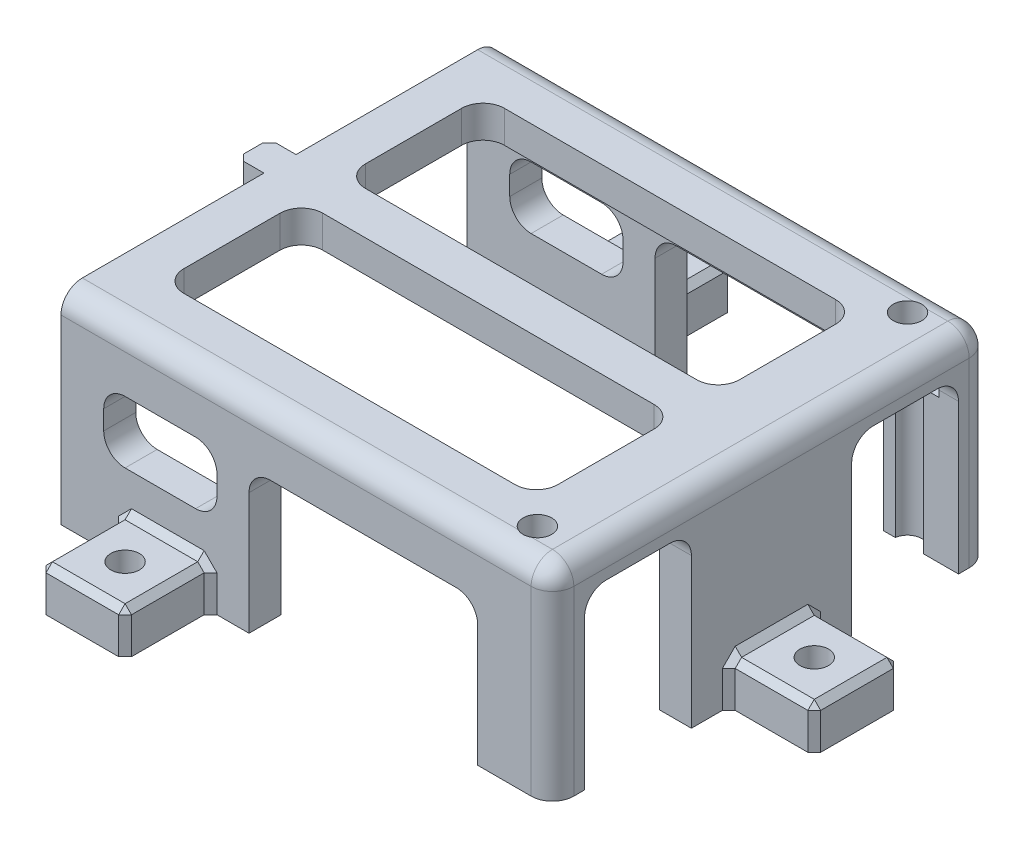
from build123d import *

# Parameters (mm, degrees)
BOSS_EXTRUDE1_DEPTH      = 20.32
SKETCH2_W                = 58.42
SKETCH2_H                = 52.07
BOSS_EXTRUDE2_DEPTH      = 3.81
SKETCH3_W                = 12.7
SKETCH3_H                = 20.32
CUT_EXTRUDE1_DEPTH       = 3.81
FILLET2_R                = 2.54
SKETCH4_W                = 10.16
SKETCH4_H                = 5.08
BOSS_EXTRUDE3_DEPTH      = 10.16
CHAMFER1_SIZE            = 0.762
SKETCH5_W                = 10.16
SKETCH5_H                = 5.08
BOSS_EXTRUDE4_DEPTH      = 10.16
CHAMFER2_SIZE            = 0.762
CHAMFER2_OF_MIRROR1_SIZE = 0.762
M3_CLEARANCE_HOLE1_D     = 3.4
M3_CLEARANCE_HOLE2_D     = 3.4
CUT_EXTRUDE2_REACH       = 61.966
SKETCH13_W               = 44.45
SKETCH13_H               = 16.51
SKETCH15_W               = 13.462
SKETCH15_H               = 7.366
CUT_EXTRUDE4_DEPTH       = 79.475827011
FILLET3_R                = 2.54
SKETCH16_W               = 6.35
SKETCH16_H               = 3.81
BOSS_EXTRUDE5_DEPTH      = 3.81
CHAMFER3_SIZE            = 0.762
M3_CLEARANCE_HOLE4_D     = 3.4
CUT_EXTRUDE5_DEPTH       = 3.302
FILLET4_R                = 2.54


with BuildPart() as part:
    # Sketch1 → Boss-Extrude1 (new body)
    with BuildSketch(Plane(origin=(0, 0, 0), x_dir=(1, 0, 0), z_dir=(0, 1, 0))):
        Polygon((-27.305, 22.225), (-27.305, 26.035), (31.115, 26.035), (31.115, -26.035), (-27.305, -26.035), (-27.305, -22.225), (27.305, -22.225), (27.305, 22.225), align=None)
    extrude(amount=BOSS_EXTRUDE1_DEPTH)

    # Sketch2 → Boss-Extrude2 (add)
    with BuildSketch(Plane(origin=(0, 20.32, 0), x_dir=(1, 0, 0), z_dir=(0, 1, 0))):
        with Locations((1.905, 0)):
            Rectangle(SKETCH2_W, SKETCH2_H)
    extrude(amount=BOSS_EXTRUDE2_DEPTH)

    # Sketch3 → Cut-Extrude1 (cut)
    with BuildSketch(Plane.ZY.offset(-27.305)):
        with Locations((-15.875, 10.16)):
            Rectangle(SKETCH3_W, SKETCH3_H)
        with Locations((15.875, 10.16)):
            Rectangle(SKETCH3_W, SKETCH3_H)
    extrude(amount=-CUT_EXTRUDE1_DEPTH, mode=Mode.SUBTRACT)

    # Fillet2
    fillet2_edges = [part.edges().sort_by_distance(p)[0] for p in [
        (31.115, 12.065, -26.035),
        (31.115, 12.065, 26.035),
        (31.115, 24.13, 0),
    ]]
    fillet(fillet2_edges, radius=FILLET2_R)

    # Sketch4 → Boss-Extrude3 (add)
    with BuildSketch(Plane(origin=(31.115, 0, 0), x_dir=(0, 0, -1), z_dir=(1, 0, 0))):
        with Locations((0, 2.54)):
            Rectangle(SKETCH4_W, SKETCH4_H)
    extrude(amount=BOSS_EXTRUDE3_DEPTH)

    # Chamfer1
    chamfer1_edges = [part.edges().sort_by_distance(p)[0] for p in [
        (31.115, 2.54, 5.08),
        (36.195, 5.08, 5.08),
        (31.115, 2.54, -5.08),
        (31.115, 5.08, 0),
        (36.195, 5.08, -5.08),
        (41.275, 2.54, 5.08),
        (41.275, 2.54, -5.08),
        (41.275, 5.08, 0),
    ]]
    chamfer(chamfer1_edges, length=CHAMFER1_SIZE)

    # Sketch5 → Boss-Extrude4 (add)
    with BuildSketch(Plane.XY.offset(26.035)):
        with Locations((-14.605, 2.54)):
            Rectangle(SKETCH5_W, SKETCH5_H)
    boss_extrude4 = extrude(amount=BOSS_EXTRUDE4_DEPTH)

    # Chamfer2
    chamfer2_edges = [part.edges().sort_by_distance(p)[0] for p in [
        (-19.685, 2.54, 26.035),
        (-19.685, 5.08, 31.115),
        (-9.525, 2.54, 26.035),
        (-14.605, 5.08, 26.035),
        (-9.525, 5.08, 31.115),
        (-19.685, 2.54, 36.195),
        (-9.525, 2.54, 36.195),
        (-14.605, 5.08, 36.195),
    ]]
    chamfer(chamfer2_edges, length=CHAMFER2_SIZE)

    # Mirror1: Boss-Extrude4 across plane
    add(boss_extrude4.mirror(Plane.XY))

    # Chamfer2 of Mirror1
    chamfer2_of_mirror1_edges = [part.edges().sort_by_distance(p)[0] for p in [
        (-19.685, 2.54, -26.035),
        (-19.685, 5.08, -31.115),
        (-9.525, 2.54, -26.035),
        (-14.605, 5.08, -26.035),
        (-9.525, 5.08, -31.115),
        (-19.685, 2.54, -36.195),
        (-9.525, 2.54, -36.195),
        (-14.605, 5.08, -36.195),
    ]]
    chamfer(chamfer2_of_mirror1_edges, length=CHAMFER2_OF_MIRROR1_SIZE)

    # M3 Clearance Hole1 (through all)
    with Locations(Plane(origin=(0, 5.08, 0), x_dir=(1, 0, 0), z_dir=(0, 1, 0))):
        with Locations((-14.605, -31.115)):
            m3_clearance_hole1 = Hole(M3_CLEARANCE_HOLE1_D / 2)

    # Mirror2: M3 Clearance Hole1 across plane
    add(m3_clearance_hole1.mirror(Plane.XY), mode=Mode.SUBTRACT)

    # M3 Clearance Hole2 (through all)
    with Locations(Plane(origin=(0, 5.08, 0), x_dir=(1, 0, 0), z_dir=(0, 1, 0))):
        with Locations((36.195, 0)):
            Hole(M3_CLEARANCE_HOLE2_D / 2)

    # Sketch13 → Cut-Extrude2 (cut, up to next)
    with BuildSketch(Plane(origin=(0, 24.13, 0), x_dir=(1, 0, 0), z_dir=(0, 1, 0)), mode=Mode.PRIVATE) as cut_extrude2_sk1:
        with Locations((0, -10.795)):
            Rectangle(SKETCH13_W, SKETCH13_H)
    cut_extrude2_tool1 = extrude(cut_extrude2_sk1.sketch, amount=-CUT_EXTRUDE2_REACH, mode=Mode.PRIVATE) & part.part
    # Sketch13 → Cut-Extrude2 (cut, up to next)
    with BuildSketch(Plane(origin=(0, 24.13, 0), x_dir=(1, 0, 0), z_dir=(0, 1, 0)), mode=Mode.PRIVATE) as cut_extrude2_sk2:
        with Locations((0, 10.795)):
            Rectangle(SKETCH13_W, SKETCH13_H)
    cut_extrude2_tool2 = extrude(cut_extrude2_sk2.sketch, amount=-CUT_EXTRUDE2_REACH, mode=Mode.PRIVATE) & part.part
    add(cut_extrude2_tool1.solids().sort_by_distance((0, 24.13, 10.795))[0], mode=Mode.SUBTRACT)
    add(cut_extrude2_tool2.solids().sort_by_distance((0, 24.13, -10.795))[0], mode=Mode.SUBTRACT)

    # Sketch15 → Cut-Extrude4 (cut, through all)
    with BuildSketch(Plane(origin=(0, 0, -26.035), x_dir=(-1, 0, 0), z_dir=(0, 0, -1))):
        Polygon((-22.225, 0), (4.953, 0), (4.953, 9.652), (4.953, 17.018), (-22.225, 17.018), align=None)
        with Locations((15.494, 13.335)):
            Rectangle(SKETCH15_W, SKETCH15_H)
    extrude(amount=-CUT_EXTRUDE4_DEPTH, mode=Mode.SUBTRACT)

    # Fillet3
    fillet3_edges = [part.edges().sort_by_distance(p)[0] for p in [
        (-22.225, 22.225, 19.05),
        (-22.225, 22.225, 2.54),
        (1.905, 20.32, -22.225),
        (22.225, 22.225, 2.54),
        (22.225, 22.225, 19.05),
        (22.225, 22.225, -19.05),
        (22.225, 22.225, -2.54),
        (-22.225, 22.225, -2.54),
        (-22.225, 22.225, -19.05),
        (22.225, 17.018, 24.13),
        (22.225, 17.018, -24.13),
        (-4.953, 17.018, 24.13),
        (-4.953, 17.018, -24.13),
        (-22.225, 17.018, 24.13),
        (-22.225, 17.018, -24.13),
        (-22.225, 9.652, 24.13),
        (-22.225, 9.652, -24.13),
        (-8.763, 9.652, 24.13),
        (-8.763, 9.652, -24.13),
        (-8.763, 17.018, 24.13),
        (-8.763, 17.018, -24.13),
        (29.21, 20.32, -9.525),
        (29.21, 20.32, 9.525),
        (1.905, 20.32, 22.225),
    ]]
    fillet(fillet3_edges, radius=FILLET3_R)

    # Sketch16 → Boss-Extrude5 (add)
    with BuildSketch(Plane(origin=(0, 24.13, 0), x_dir=(1, 0, 0), z_dir=(0, 1, 0))):
        with Locations((-27.305, 0)):
            Rectangle(SKETCH16_W, SKETCH16_H)
    extrude(amount=-BOSS_EXTRUDE5_DEPTH)

    # Chamfer3
    chamfer3_edges = [part.edges().sort_by_distance(p)[0] for p in [
        (-28.8925, 20.32, -1.905),
        (-28.8925, 20.32, 1.905),
        (-30.48, 20.32, 0),
        (-30.48, 22.225, -1.905),
        (-30.48, 22.225, 1.905),
    ]]
    chamfer(chamfer3_edges, length=CHAMFER3_SIZE)

    # M3 Clearance Hole4 (through all)
    with Locations(Plane(origin=(0, 24.13, 0), x_dir=(1, 0, 0), z_dir=(0, 1, 0))):
        with Locations((25.286866606, -21.9964), (25.286866606, 21.9964)):
            Hole(M3_CLEARANCE_HOLE4_D / 2)

    # Sketch22 → Cut-Extrude5 (cut)
    with BuildSketch(Plane.XZ.offset(-20.32)):
        Polygon((28.953040816, 21.9964), (27.119953711, 25.1714), (23.453779502, 25.1714), (21.620692397, 21.9964), (23.453779502, 18.8214), (27.119953711, 18.8214), align=None)
        Polygon((28.953040816, -21.9964), (27.119953711, -18.8214), (23.453779502, -18.8214), (21.620692397, -21.9964), (23.453779502, -25.1714), (27.119953711, -25.1714), align=None)
    extrude(amount=CUT_EXTRUDE5_DEPTH, mode=Mode.SUBTRACT)

    # Fillet4
    # the kernel refuses this fillet: 2.54 mm, written as the material it takes off along each edge
    with BuildSketch(Plane(origin=(28.575, 21.59, 23.495), x_dir=(0, 0, 1), z_dir=(0, 1, 0))) as fillet4_piece_1_section:
        Polygon((0, 0), (FILLET4_R, 0), (FILLET4_R, FILLET4_R), (0, FILLET4_R), align=None)
    fillet4_piece_1 = extrude(amount=FILLET4_R, mode=Mode.PRIVATE)
    fillet4_piece_1 = fillet4_piece_1 - Plane(origin=(28.575, 21.59, 23.495), x_dir=(-0.7071067811865475, 0, -0.7071067811865475), z_dir=(0, 1, 0)) * Sphere(FILLET4_R, mode=Mode.PRIVATE)
    add(fillet4_piece_1, mode=Mode.SUBTRACT)
    with BuildSketch(Plane(origin=(28.575, 21.59, -23.495), x_dir=(0, 0, -1), z_dir=(0, 1, 0))) as fillet4_piece_2_section:
        Polygon((0, 0), (FILLET4_R, 0), (FILLET4_R, -FILLET4_R), (0, -FILLET4_R), align=None)
    fillet4_piece_2 = extrude(amount=FILLET4_R, mode=Mode.PRIVATE)
    fillet4_piece_2 = fillet4_piece_2 - Plane(origin=(28.575, 21.59, -23.495), x_dir=(-0.7071067811865475, 0, 0.7071067811865475), z_dir=(0, 1, 0)) * Sphere(FILLET4_R, mode=Mode.PRIVATE)
    add(fillet4_piece_2, mode=Mode.SUBTRACT)
    with BuildSketch(Plane(origin=(28.575, 24.13, 26.035), x_dir=(0, 0, -1), z_dir=(-1, 0, 0)), Plane(origin=(-33.655, 24.13, -26.035), x_dir=(0, 0, 1), z_dir=(1, 0, 0))) as fillet4_piece_3:
        with BuildLine():
            CenterArc((FILLET4_R, FILLET4_R), FILLET4_R, 180, 90)
            Line((0, FILLET4_R), (0, 0))
            Line((0, 0), (FILLET4_R, 0))
        make_face()
    extrude(amount=62.23, mode=Mode.SUBTRACT)


solid = part.part
